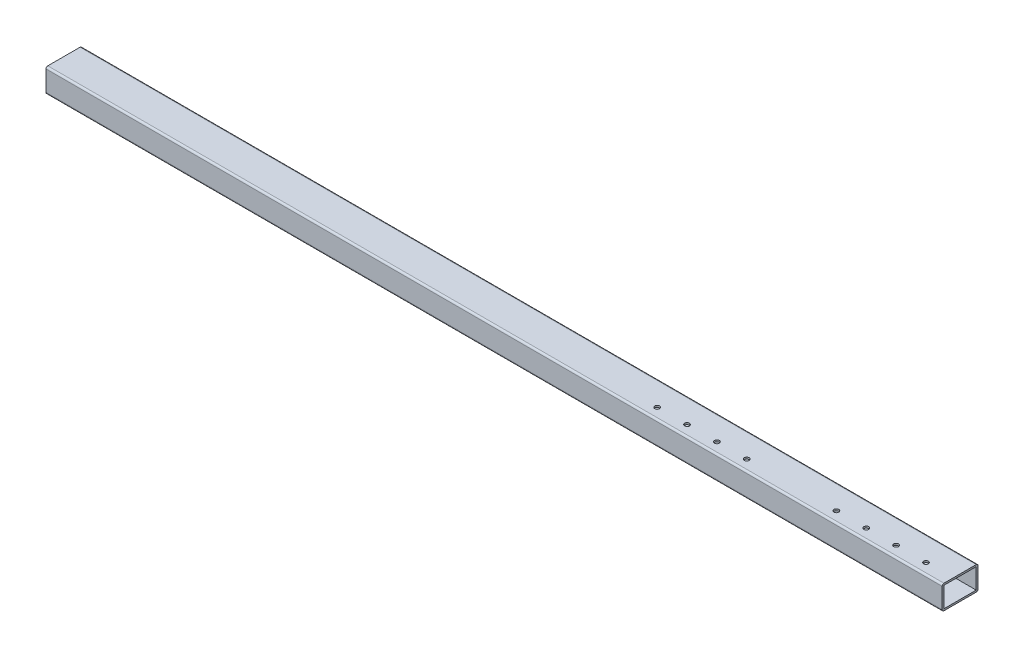
from build123d import *

# Parameters (mm, degrees)
SKETCH_1_W          = 54
SKETCH_1_H          = 34
EXTRUDE_1_DEPTH     = 1500
SKETCH_2_R          = 4.05
CUT_EXTRUDE_1_DEPTH = 1501.83310198


with BuildPart() as part:
    # Эскиз1 → Вытянуть-Тонкостенный1 (new body)
    with BuildSketch(Plane(origin=(0, 0, 0), x_dir=(0, 0, -1), z_dir=(1, 0, 0))):
        with BuildLine():
            Line((30, 17), (30, -17))
            ThreePointArc((30, -17), (29.121320344, -19.121320344), (27, -20))
            Line((27, -20), (-27, -20))
            ThreePointArc((-27, -20), (-29.121320344, -19.121320344), (-30, -17))
            Line((-30, -17), (-30, 17))
            ThreePointArc((-30, 17), (-29.121320344, 19.121320344), (-27, 20))
            Line((-27, 20), (27, 20))
            ThreePointArc((27, 20), (29.121320344, 19.121320344), (30, 17))
        make_face()
        Rectangle(SKETCH_1_W, SKETCH_1_H, mode=Mode.SUBTRACT)
    extrude(amount=EXTRUDE_1_DEPTH)

    # Эскиз2 → Вырез-Вытянуть1 (cut, through all)
    with BuildSketch(Plane(origin=(0, 20, 0), x_dir=(1, 0, 0), z_dir=(0, 1, 0))):
        with Locations((1455, -12)):
            Circle(SKETCH_2_R)
        with Locations((1405, -12)):
            Circle(SKETCH_2_R)
        with Locations((1355, -12)):
            Circle(SKETCH_2_R)
        with Locations((1305, -12)):
            Circle(SKETCH_2_R)
        with Locations((1155, -12)):
            Circle(SKETCH_2_R)
        with Locations((1105, -12)):
            Circle(SKETCH_2_R)
        with Locations((1055, -12)):
            Circle(SKETCH_2_R)
        with Locations((1005, -12)):
            Circle(SKETCH_2_R)
    extrude(amount=-CUT_EXTRUDE_1_DEPTH, mode=Mode.SUBTRACT)


solid = part.part
